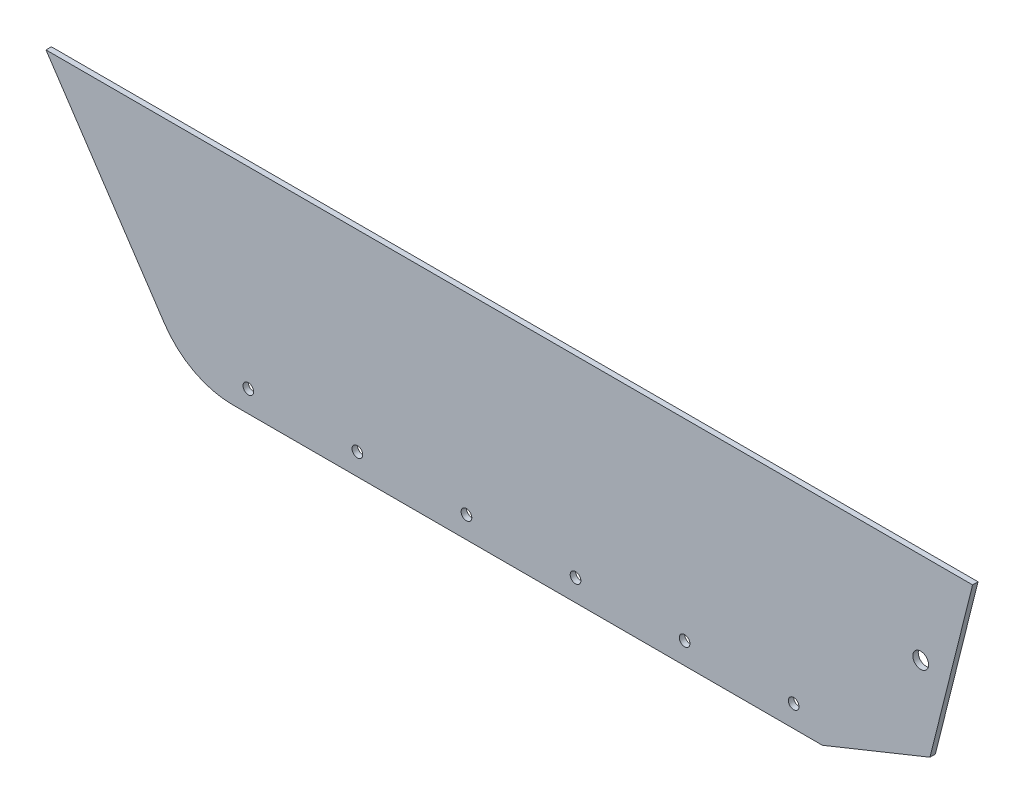
from build123d import *

# Parameters (mm, degrees)
BOSS_EXTRUDE1_DEPTH = 3.175
SKETCH1_4_R         = 3.125
CUT_EXTRUDE1_DEPTH  = 439.905857431
FILLET1_R           = 48
CUT_EXTRUDE3_DEPTH  = 10
CUT_EXTRUDE5_REACH  = 440.906
SKETCH11_R          = 4.625


with BuildPart() as part:
    # Sketch1 → Boss-Extrude1 (new body)
    with BuildSketch(Plane.XY):
        Polygon((-98.879411765, 3.850980392), (-31.879411765, -96.649019608), (366, -96.649019608), (403.120588235, -71.149019608), (428.120588235, 28.939617947), (-115.605170134, 28.939617947), align=None)
    extrude(amount=BOSS_EXTRUDE1_DEPTH)

    # Sketch1<4> → Cut-Extrude1 (cut, through all)
    with BuildSketch(Plane.XY):
        with Locations((3.120588235, -83.899019608)):
            Circle(SKETCH1_4_R)
        with Locations((67.120588235, -83.899019608)):
            Circle(SKETCH1_4_R)
        with Locations((131.120588235, -83.899019608)):
            Circle(SKETCH1_4_R)
        with Locations((195.120588235, -83.899019608)):
            Circle(SKETCH1_4_R)
        with Locations((259.120588235, -83.899019608)):
            Circle(SKETCH1_4_R)
        with Locations((323.120588235, -83.899019608)):
            Circle(SKETCH1_4_R)
    extrude(amount=CUT_EXTRUDE1_DEPTH, mode=Mode.SUBTRACT)

    # Fillet1
    fillet1_edges = [part.edges().sort_by_distance(p)[0] for p in [
        (-31.879411765, -96.649019608, 1.5875),
    ]]
    fillet(fillet1_edges, radius=FILLET1_R)

    # Sketch7 → Cut-Extrude3 (cut)
    with BuildSketch(Plane.XY.offset(3.175)):
        Polygon((403.120588235, -71.149019608), (340.005873473, -96.649019608), (366, -96.649019608), align=None)
    extrude(amount=-CUT_EXTRUDE3_DEPTH, mode=Mode.SUBTRACT)

    # Sketch11 → Cut-Extrude5 (cut, up to next)
    with BuildSketch(Plane(origin=(0, 0, 0), x_dir=(-1, 0, 0), z_dir=(0, 0, -1)), mode=Mode.PRIVATE) as cut_extrude5_sk1:
        with Locations((-397.678558137, -24.610405219)):
            Circle(SKETCH11_R)
    cut_extrude5_tool1 = extrude(cut_extrude5_sk1.sketch, amount=-CUT_EXTRUDE5_REACH, mode=Mode.PRIVATE) & part.part
    add(cut_extrude5_tool1.solids().sort_by_distance((397.678558, -24.610405, 0))[0], mode=Mode.SUBTRACT)


solid = part.part
